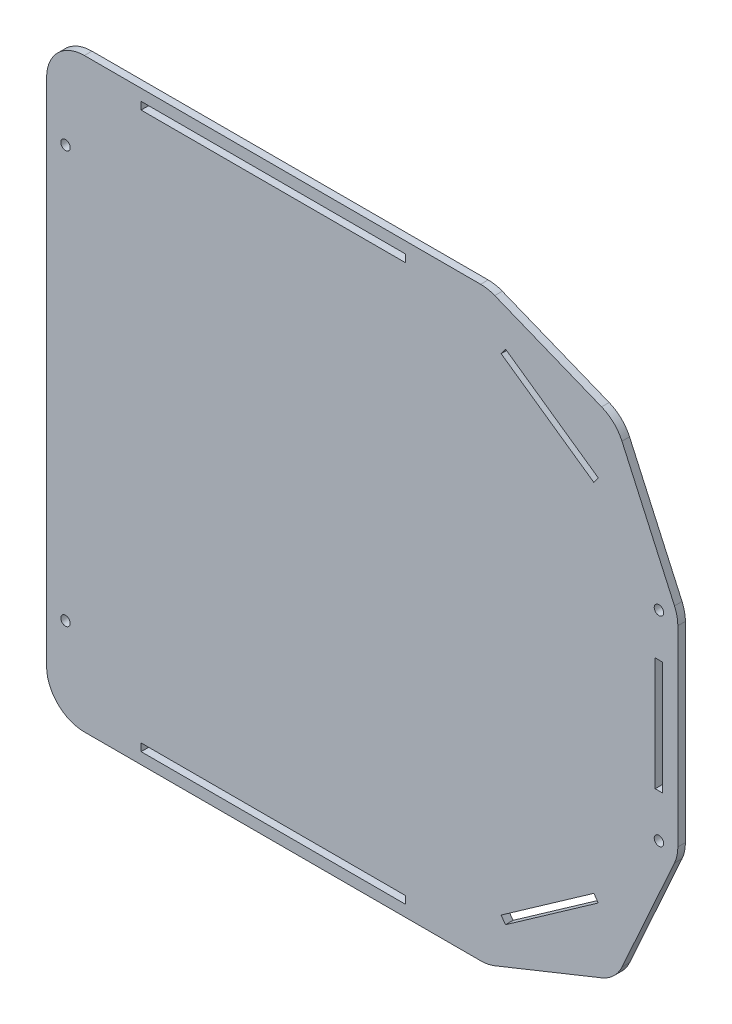
from build123d import *

# Parameters (mm, degrees)
ESTRUSIONE_ESTRUSIONE1_DEPTH = 2
FORO_FILETTATO_M3X0_5_1_D    = 2.5
SCHIZZO4_W                   = 70
SCHIZZO4_H                   = 2
TAGLIO_ESTRUSIONE1_DEPTH     = 10
FORO_FILETTATO_M3X0_5_2_D    = 2.5
SCHIZZO7_W                   = 2
SCHIZZO7_H                   = 30
TAGLIO_ESTRUSIONE2_DEPTH     = 10
RACCORDO1_R                  = 10
RACCORDO2_R                  = 10


with BuildPart() as part:
    # Schizzo1 → Estrusione-Estrusione1 (new body)
    with BuildSketch(Plane.XY):
        Polygon((25.764676516, -77.5), (59.567435258, -63.90932479), (76, -27.5), (76, 27.5), (59.567435258, 63.90932479), (25.764676516, 77.5), (-91, 77.5), (-91, -77.5), align=None)
    extrude(amount=ESTRUSIONE_ESTRUSIONE1_DEPTH)

    # Foro filettato M3x0.5-1 (through all)
    with Locations(Plane(origin=(0, 0, 0), x_dir=(-1, 0, 0), z_dir=(0, 0, -1))):
        with Locations((86, -54.5), (86, 54.5)):
            Hole(FORO_FILETTATO_M3X0_5_1_D / 2)

    # Schizzo4 → Taglio-Estrusione1 (cut)
    with BuildSketch(Plane(origin=(0, 0, 0), x_dir=(-1, 0, 0), z_dir=(0, 0, -1))):
        with Locations((31, -73.5)):
            Rectangle(SCHIZZO4_W, SCHIZZO4_H)
        with Locations((31, 73.5)):
            Rectangle(SCHIZZO4_W, SCHIZZO4_H)
    extrude(amount=-TAGLIO_ESTRUSIONE1_DEPTH, mode=Mode.SUBTRACT)

    # Foro filettato M3x0.5-2 (through all)
    with Locations(Plane.XY.offset(2)):
        with Locations((71, 26.42393853), (71, -26.42393853)):
            Hole(FORO_FILETTATO_M3X0_5_2_D / 2)

    # Schizzo7 → Taglio-Estrusione2 (cut)
    with BuildSketch(Plane.XY.offset(2)):
        Polygon((30.400832321, 65.949521243), (54.947448301, 48.702386874), (53.797639343, 47.065945809), (29.251023363, 64.313080178), align=None)
        Polygon((53.797639343, -47.065945809), (29.251023363, -64.313080178), (30.400832321, -65.949521243), (54.947448301, -48.702386874), align=None)
        with Locations((71, 0)):
            Rectangle(SCHIZZO7_W, SCHIZZO7_H)
    extrude(amount=-TAGLIO_ESTRUSIONE2_DEPTH, mode=Mode.SUBTRACT)

    # Raccordo1
    raccordo1_edges = [part.edges().sort_by_distance(p)[0] for p in [
        (-91, 77.5, 1),
        (-91, -77.5, 1),
    ]]
    fillet(raccordo1_edges, radius=RACCORDO1_R)

    # Raccordo2
    raccordo2_edges = [part.edges().sort_by_distance(p)[0] for p in [
        (25.764676516, -77.5, 1),
        (59.567435258, -63.90932479, 1),
        (76, -27.5, 1),
        (76, 27.5, 1),
        (59.567435258, 63.90932479, 1),
        (25.764676516, 77.5, 1),
    ]]
    fillet(raccordo2_edges, radius=RACCORDO2_R)


solid = part.part
